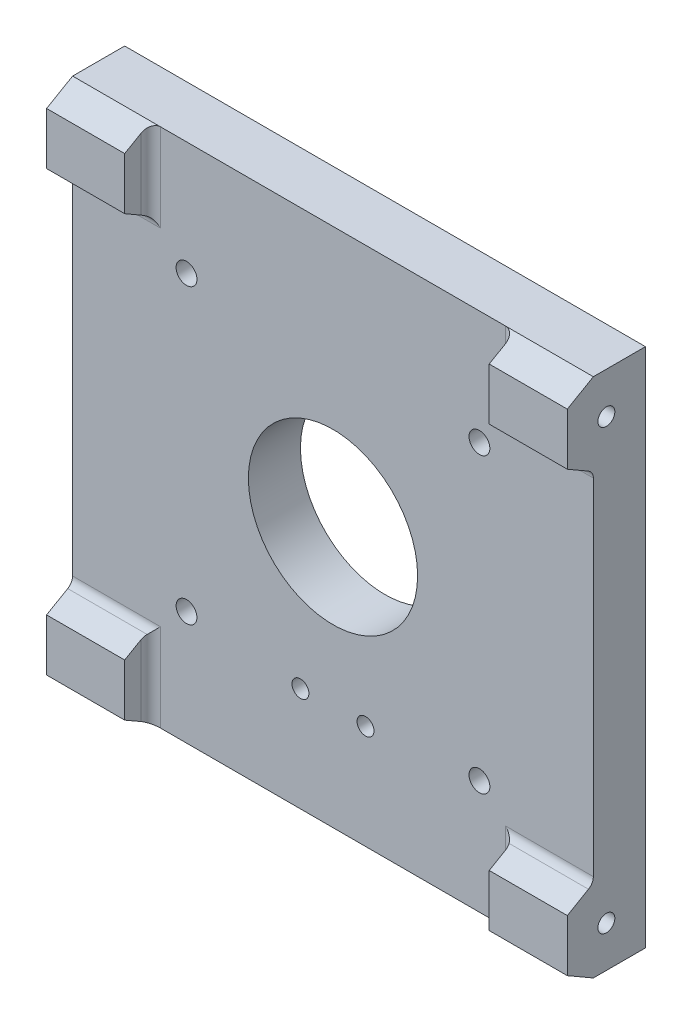
from build123d import *

# Parameters (mm, degrees)
SKETCH_1_W             = 80
SKETCH_1_H             = 80
EXTRUDE_1_DEPTH        = 8
SKETCH_6_R             = 13
CUT_EXTRUDE_3_DEPTH    = 50
EXTRUDE_2_DEPTH        = 12
FILLET_1_R             = 1.5
FILLET_1_OF_MIRROR_1_R = 1.5
SKETCH_8_R             = 1.3
CUT_EXTRUDE_4_DEPTH    = 10
SKETCH_9_R             = 1.3
CUT_EXTRUDE_5_DEPTH    = 10
SKETCH_10_R            = 1.6
CUT_EXTRUDE_6_DEPTH    = 10


with BuildPart() as part:
    # 草图1 → 凸台-拉伸1 (new body)
    with BuildSketch(Plane.XY):
        Rectangle(SKETCH_1_W, SKETCH_1_H)
    extrude(amount=EXTRUDE_1_DEPTH)

    # 草图6 → 切除-拉伸3 (cut)
    with BuildSketch(Plane.XY.offset(8)):
        Circle(SKETCH_6_R)
    extrude(amount=-CUT_EXTRUDE_3_DEPTH, mode=Mode.SUBTRACT)

    # 草图7 → 凸台-拉伸2 (add)
    with BuildSketch(Plane.ZY.offset(40)):
        Polygon((8, 40), (8, 27.381197846), (12, 29.690598923), (12, 37.690598923), align=None)
        Polygon((12, -37.690598923), (8, -40), (8, -27.381197846), (12, -29.690598923), align=None)
    extrude_2 = extrude(amount=-EXTRUDE_2_DEPTH)

    # 圆角1
    fillet_1_edges = [part.edges().sort_by_distance(p)[0] for p in [
        (-34, 27.381197846, 8),
        (-28, 33.690598923, 8),
        (-28, -33.690598923, 8),
        (-34, -27.381197846, 8),
    ]]
    fillet(fillet_1_edges, radius=FILLET_1_R)

    # 镜向1: 凸台-拉伸2 across plane
    add(extrude_2.mirror(Plane(origin=(0, 0, 0), x_dir=(0, 0, 1), z_dir=(1, 0, 0))))

    # 圆角1 of 镜向1
    fillet_1_of_mirror_1_edges = [part.edges().sort_by_distance(p)[0] for p in [
        (34, 27.381197846, 8),
        (28, 33.690598923, 8),
        (28, -33.690598923, 8),
        (34, -27.381197846, 8),
    ]]
    fillet(fillet_1_of_mirror_1_edges, radius=FILLET_1_OF_MIRROR_1_R)

    # 草图8 → 切除-拉伸4 (cut)
    with BuildSketch(Plane.ZY.offset(40)):
        with Locations((6, 33.690598923)):
            Circle(SKETCH_8_R)
        with Locations((6, -33.690598923)):
            Circle(SKETCH_8_R)
    cut_extrude_4 = extrude(amount=-CUT_EXTRUDE_4_DEPTH, mode=Mode.SUBTRACT)

    # 镜向2: 切除-拉伸4 across plane
    add(cut_extrude_4.mirror(Plane(origin=(0, 0, 0), x_dir=(0, 0, 1), z_dir=(1, 0, 0))), mode=Mode.SUBTRACT)

    # 草图9 → 切除-拉伸5 (cut)
    with BuildSketch(Plane.XY.offset(8)):
        with Locations((5, -24)):
            Circle(SKETCH_9_R)
        with Locations((-5, -24)):
            Circle(SKETCH_9_R)
    extrude(amount=-CUT_EXTRUDE_5_DEPTH, mode=Mode.SUBTRACT)

    # 草图10 → 切除-拉伸6 (cut)
    with BuildSketch(Plane.XY.offset(8)):
        with Locations((22.5, -22.5)):
            Circle(SKETCH_10_R)
        with Locations((-22.5, -22.5)):
            Circle(SKETCH_10_R)
        with Locations((22.5, 22.5)):
            Circle(SKETCH_10_R)
        with Locations((-22.5, 22.5)):
            Circle(SKETCH_10_R)
    extrude(amount=-CUT_EXTRUDE_6_DEPTH, mode=Mode.SUBTRACT)


solid = part.part
